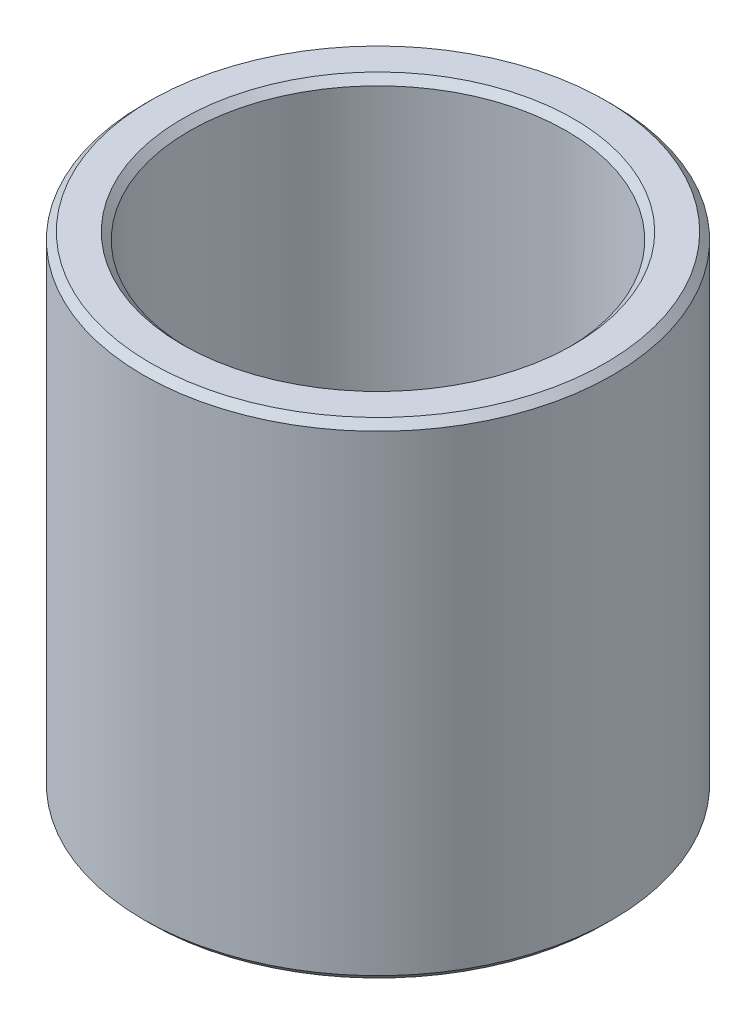
from build123d import *

# Parameters (mm, degrees)
SKETCH1_R           = 42.5
BOSS_EXTRUDE1_DEPTH = 87.989968221
SKETCH2_R           = 34.188270206
CUT_EXTRUDE1_DEPTH  = 107.558596592
CHAMFER1_SIZE       = 1.274595496


with BuildPart() as part:
    # Sketch1 → Boss-Extrude1 (new body)
    with BuildSketch(Plane(origin=(0, 0, 0), x_dir=(1, 0, 0), z_dir=(0, 1, 0))):
        Circle(SKETCH1_R)
    extrude(amount=BOSS_EXTRUDE1_DEPTH)

    # Sketch2 → Cut-Extrude1 (cut, through all)
    with BuildSketch(Plane(origin=(0, 0, 0), x_dir=(1, 0, 0), z_dir=(0, 1, 0))):
        Circle(SKETCH2_R)
    extrude(amount=CUT_EXTRUDE1_DEPTH, mode=Mode.SUBTRACT)

    # Chamfer1
    chamfer1_edges = [part.edges().sort_by_distance(p)[0] for p in [
        (-34.188270206, 87.989968221, 0),
        (-34.188270206, 0, 0),
        (-42.5, 0, 0),
        (-42.5, 87.989968221, 0),
    ]]
    chamfer(chamfer1_edges, length=CHAMFER1_SIZE)


solid = part.part
